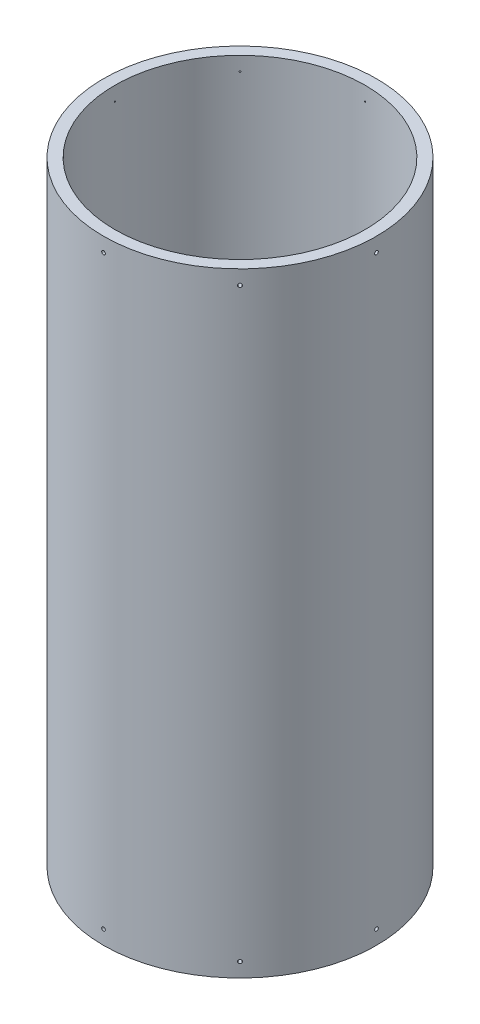
from build123d import *

# Parameters (mm, degrees)
SKETCH1_R                       = 152.4
SKETCH1_R_2                     = 139.7
BOSS_EXTRUDE1_DEPTH             = 685.8
F_10_32_TAPPED_HOLE1_AT_2_COUNT = 2
F_10_32_TAPPED_HOLE1_AT_2_PITCH = 654.05
CIRPATTERN1_COUNT               = 8
HOLE1_REACH                     = 767.801
HOLE1_BORE_R                    = 22.225


with BuildPart() as part:
    # Sketch1 → Boss-Extrude1 (new body)
    with BuildSketch(Plane(origin=(0, 0, 0), x_dir=(1, 0, 0), z_dir=(0, 1, 0))):
        Circle(SKETCH1_R)
        Circle(SKETCH1_R_2, mode=Mode.SUBTRACT)
    extrude(amount=BOSS_EXTRUDE1_DEPTH)

    # Sketch3 → #10-32 Tapped Hole1 (revolve, cut)
    with BuildSketch(Plane(origin=(0, 669.925, 152.4), x_dir=(0, -1, 0), z_dir=(1, 0, 0))):
        Polygon((0, 0), (0, 13.151317848), (2.0193, 11.938), (2.0193, 0), align=None)
    f_10_32_tapped_hole1 = revolve(axis=Axis((0, 669.925, 158.75), (0, 0, -1)), mode=Mode.SUBTRACT)

    # #10-32 Tapped Hole1 at 2: #10-32 Tapped Hole1 ×2
    with Locations(*[(0, -i * F_10_32_TAPPED_HOLE1_AT_2_PITCH, 0) for i in range(1, F_10_32_TAPPED_HOLE1_AT_2_COUNT)]):
        add(f_10_32_tapped_hole1, mode=Mode.SUBTRACT)

    # CirPattern1: #10-32 Tapped Hole1 ×8 about axis
    cirpattern1_axis = Axis((0, 0, 0), (0, 1, 0))
    for i in range(1, CIRPATTERN1_COUNT):
        add(f_10_32_tapped_hole1.rotate(cirpattern1_axis, i * 360 / CIRPATTERN1_COUNT), mode=Mode.SUBTRACT)

    # CirPattern1 copy 1 sketch → CirPattern1 copy 1 (revolve, cut)
    with BuildSketch(Plane(origin=(107.763073453, 15.875, 107.763073453), x_dir=(0, -1, 0), z_dir=(0.7071067811865476, 0, -0.7071067811865475))):
        Polygon((0, 0), (0, 13.151317848), (2.0193, 11.938), (2.0193, 0), align=None)
    revolve(axis=Axis((112.253201513, 15.875, 112.253201513), (-0.7071067811865475, 0, -0.7071067811865476)), mode=Mode.SUBTRACT)

    # CirPattern1 copy 2 sketch → CirPattern1 copy 2 (revolve, cut)
    with BuildSketch(Plane(origin=(152.4, 15.875, 0), x_dir=(0, -1, 0), z_dir=(0, 0, -1))):
        Polygon((0, 0), (0, 13.151317848), (2.0193, 11.938), (2.0193, 0), align=None)
    revolve(axis=Axis((158.75, 15.875, 0), (-1, 0, 0)), mode=Mode.SUBTRACT)

    # CirPattern1 copy 3 sketch → CirPattern1 copy 3 (revolve, cut)
    with BuildSketch(Plane(origin=(107.763073453, 15.875, -107.763073453), x_dir=(0, -1, 0), z_dir=(-0.7071067811865475, 0, -0.7071067811865476))):
        Polygon((0, 0), (0, 13.151317848), (2.0193, 11.938), (2.0193, 0), align=None)
    revolve(axis=Axis((112.253201513, 15.875, -112.253201513), (-0.7071067811865476, 0, 0.7071067811865475)), mode=Mode.SUBTRACT)

    # CirPattern1 copy 4 sketch → CirPattern1 copy 4 (revolve, cut)
    with BuildSketch(Plane(origin=(0, 15.875, -152.4), x_dir=(0, -1, 0), z_dir=(-1, 0, 0))):
        Polygon((0, 0), (0, 13.151317848), (2.0193, 11.938), (2.0193, 0), align=None)
    revolve(axis=Axis((0, 15.875, -158.75), (0, 0, 1)), mode=Mode.SUBTRACT)

    # CirPattern1 copy 5 sketch → CirPattern1 copy 5 (revolve, cut)
    with BuildSketch(Plane(origin=(-107.763073453, 15.875, -107.763073453), x_dir=(0, -1, 0), z_dir=(-0.7071067811865477, 0, 0.7071067811865475))):
        Polygon((0, 0), (0, 13.151317848), (2.0193, 11.938), (2.0193, 0), align=None)
    revolve(axis=Axis((-112.253201513, 15.875, -112.253201513), (0.7071067811865475, 0, 0.7071067811865477)), mode=Mode.SUBTRACT)

    # CirPattern1 copy 6 sketch → CirPattern1 copy 6 (revolve, cut)
    with BuildSketch(Plane(origin=(-152.4, 15.875, 0), x_dir=(0, -1, 0), z_dir=(0, 0, 1))):
        Polygon((0, 0), (0, 13.151317848), (2.0193, 11.938), (2.0193, 0), align=None)
    revolve(axis=Axis((-158.75, 15.875, 0), (1, 0, 0)), mode=Mode.SUBTRACT)

    # CirPattern1 copy 7 sketch → CirPattern1 copy 7 (revolve, cut)
    with BuildSketch(Plane(origin=(-107.763073453, 15.875, 107.763073453), x_dir=(0, -1, 0), z_dir=(0.7071067811865474, 0, 0.7071067811865477))):
        Polygon((0, 0), (0, 13.151317848), (2.0193, 11.938), (2.0193, 0), align=None)
    revolve(axis=Axis((-112.253201513, 15.875, 112.253201513), (0.7071067811865477, 0, -0.7071067811865474)), mode=Mode.SUBTRACT)

    # Hole1 bore → Hole1 (cut, up to next)
    with BuildSketch(Plane(origin=(-152.4, 0, 0), x_dir=(0, 0, -1), z_dir=(-1, 0, 0)), mode=Mode.PRIVATE) as hole1_sk1:
        with Locations((0, -104.775)):
            Circle(HOLE1_BORE_R)
    hole1_tool1 = extrude(hole1_sk1.sketch, amount=-HOLE1_REACH, mode=Mode.PRIVATE) & part.part
    add(hole1_tool1.solids().sort_by_distance((-152.4, 104.775, 0))[0], mode=Mode.SUBTRACT)


solid = part.part
